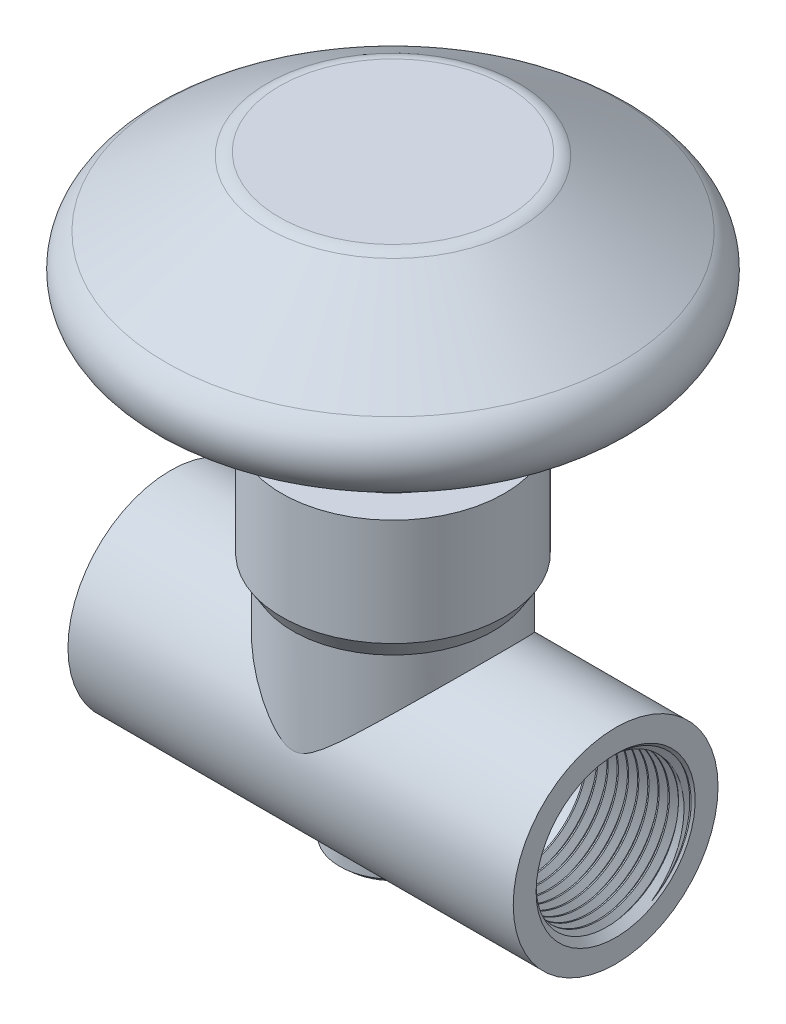
from build123d import *

# Parameters (mm, degrees)
CUT_EXTRUDE1_DEPTH      = 51.245315516
CUT_EXTRUDE1_DEPTH_BACK = 51.245315516
SKETCH3_R               = 10.668
CUT_EXTRUDE2_DEPTH      = 10.16
SWEEP1_PITCH            = 1.411794907
SWEEP1_HEIGHT           = 15.24
SWEEP1_RADIUS           = 10.668
SWEEP1_START_ANGLE      = -90
SKETCH9_R               = 11.3440667
CUT_EXTRUDE3_DEPTH      = 103.685606377


with BuildPart() as part:
    # Sketch1 → Revolve1 (revolve)
    with BuildSketch(Plane.XY, mode=Mode.PRIVATE) as revolve1_sk:
        Polygon((-31.75, 11.0900667), (-31.75, 14.605), (31.75, 14.605), (31.75, 11.0900667), (18.19402, 10.668), (-18.19402, 10.668), align=None)
    revolve(revolve1_sk.sketch.rotate(Axis((-31.75, 0, 0), (1, 0, 0)), 90), axis=Axis((-31.75, 0, 0), (1, 0, 0)))

    # Sketch2 → Revolve2 (revolve)
    with BuildSketch(Plane.XY):
        with BuildLine():
            Line((0, -17.78), (0, 14.605))
            Line((0, 14.605), (-9.525, 14.605))
            Line((-9.525, 14.605), (-9.525, 35.56))
            Line((-9.525, 35.56), (-15.875, 35.56))
            Line((-15.875, 35.56), (-15.875, 20.32))
            Line((-15.875, 20.32), (-14.2875, 17.78))
            Line((-14.2875, 17.78), (-14.2875, 0))
            Line((-14.2875, 0), (-7.62, 0))
            Line((-7.62, 0), (-7.62, -14.605))
            ThreePointArc((-7.62, -14.605), (-4.1275, -16.9545), (0, -17.78))
        make_face()
    revolve(axis=Axis((0, 35.56, 0), (0, -1, 0)))

    # Sketch3 → Cut-Extrude1 (cut, two sides: drawn at the far end of the back side and taken through both)
    with BuildSketch(Plane(origin=(0, 0, 0), x_dir=(0, 0, -1), z_dir=(1, 0, 0)).offset(-CUT_EXTRUDE1_DEPTH_BACK)):
        with Locations(Location((0, 0, 0), (0, 0, 180))):
            Circle(SKETCH3_R)
    extrude(amount=CUT_EXTRUDE1_DEPTH + CUT_EXTRUDE1_DEPTH_BACK, mode=Mode.SUBTRACT)

    # Sweep1: sweep along a helix
    with BuildLine() as sweep1_path:
        # a taper helix: rise per turn along the axis 1.411111111, along the cone's slant (build123d's pitch) 1.411794907
        add(Helix(SWEEP1_PITCH, SWEEP1_HEIGHT, SWEEP1_RADIUS, center=(-18.19402, 0, 0), direction=(-1, 0, 0), cone_angle=1.78333333, mode=Mode.PRIVATE).rotate(Axis((-18.19402, 0, 0), (-1, 0, 0)), SWEEP1_START_ANGLE))
    # Sketch8 → Sweep1 (sweep)
    with BuildSketch(Plane.XY):
        Polygon((-18.19402, 10.668), (-17.664853291, 9.751456374), (-17.488464388, 9.751456374), (-16.959297679, 10.668), align=None)
    sweep1 = sweep(path=sweep1_path.line, is_frenet=True)

    # Sketch9 → Cut-Extrude3 (cut, through all)
    with BuildSketch(Plane.ZY.offset(31.75)):
        Circle(SKETCH9_R)
    cut_extrude3 = extrude(amount=CUT_EXTRUDE3_DEPTH, mode=Mode.SUBTRACT)

    # Cut-Extrude4 cone 1 section (through the dimple's axis) → Cut-Extrude4 (revolve, cut)
    with BuildSketch(Plane(origin=(-31.75, 0, 0), x_dir=(0, 0, 1), z_dir=(0, 1, 0))):
        Polygon((0, 0), (11.3440667, 0), (0, 11.3440667), align=None)
    cut_extrude4 = revolve(axis=Axis((-31.75, 0, 0), (1, 0, 0)), mode=Mode.SUBTRACT)

    # Mirror1: Sweep1, Cut-Extrude3, Cut-Extrude4 across plane
    add(sweep1.mirror(Plane(origin=(0, 0, 0), x_dir=(0, 0, 1), z_dir=(1, 0, 0))))
    add(cut_extrude3.mirror(Plane(origin=(0, 0, 0), x_dir=(0, 0, 1), z_dir=(1, 0, 0))), mode=Mode.SUBTRACT)
    add(cut_extrude4.mirror(Plane(origin=(0, 0, 0), x_dir=(0, 0, 1), z_dir=(1, 0, 0))), mode=Mode.SUBTRACT)


with BuildPart() as body_2:
    # Sketch4 → Revolve3 (revolve)
    with BuildSketch(Plane.XY):
        Polygon((0, 14.605), (0, 47.9425), (-8.41375, 47.9425), (-9.525, 46.83125), (-12.7, 46.83125), (-12.7, 36.67125), (-9.525, 36.67125), (-9.525, 14.605), align=None)
    revolve(axis=Axis((0, 14.605, 0), (0, -1, 0)))

    # Sketch5 → Cut-Extrude2 (cut)
    with BuildSketch(Plane(origin=(0, 46.83125, 0), x_dir=(1, 0, 0), z_dir=(0, 1, 0))):
        with BuildLine():
            Line((-10.2235, 7.534590085), (-10.2235, -7.534590085))
            ThreePointArc((-10.2235, -7.534590085), (-12.7, 0), (-10.2235, 7.534590085))
        make_face()
        with BuildLine():
            Line((10.2235, 7.534590085), (10.2235, -7.534590085))
            ThreePointArc((10.2235, -7.534590085), (12.7, 0), (10.2235, 7.534590085))
        make_face()
    extrude(amount=-CUT_EXTRUDE2_DEPTH, mode=Mode.SUBTRACT)


with BuildPart() as body_3:
    # Sketch6 → Revolve4 (revolve)
    with BuildSketch(Plane.XY, mode=Mode.PRIVATE) as revolve4_sk:
        with BuildLine():
            Line((0, 47.9425), (0, 69.85))
            Line((0, 69.85), (-16.208791185, 69.85))
            ThreePointArc((-16.208791185, 69.85), (-17.106774787, 69.720365405), (-17.931429419, 69.342047528))
            Line((-17.931429419, 69.342047528), (-32.38336691, 60.007583173))
            ThreePointArc((-32.38336691, 60.007583173), (-34.698139459, 53.768778696), (-29.36875, 49.784))
            Line((-29.36875, 49.784), (-6.35, 49.784))
            Line((-6.35, 49.784), (-6.35, 47.9425))
            Line((-6.35, 47.9425), (0, 47.9425))
        make_face()
    revolve(revolve4_sk.sketch.rotate(Axis((0, 47.9425, 0), (0, 1, 0)), 180), axis=Axis((0, 47.9425, 0), (0, 1, 0)))


solid = Compound([part.part, body_2.part, body_3.part])
